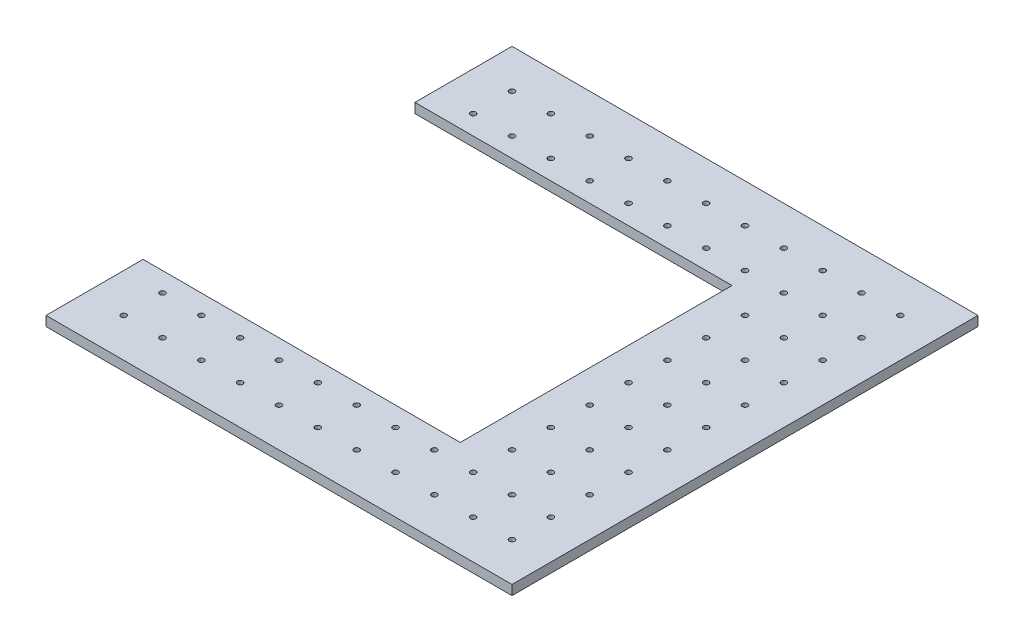
from build123d import *

# Parameters (mm, degrees)
SKETCH1_R           = 1.7907
BOSS_EXTRUDE1_DEPTH = 6.35
SKETCH2_W           = 254
SKETCH2_H           = 177.8
SKETCH2_W_2         = 311.15
SKETCH2_H_2         = 6.35
SKETCH2_W_3         = 6.35
SKETCH2_H_3         = 279.4
SKETCH2_W_4         = 279.4
CUT_EXTRUDE2_DEPTH  = 305.225337561
SKETCH3_W           = 6.35
SKETCH3_H           = 63.5
SKETCH3_H_2         = 25.4
CUT_EXTRUDE3_DEPTH  = 296.250072208


with BuildPart() as part:
    # Sketch1 → Boss-Extrude1 (new body)
    with BuildSketch(Plane(origin=(0, 0, 0), x_dir=(1, 0, 0), z_dir=(0, 1, 0))):
        Polygon((-65.292450766, -101.6), (-39.892450766, -101.6), (-39.892450766, -107.95), (-14.492450766, -107.95), (-14.492450766, -101.6), (10.907549234, -101.6), (10.907549234, -107.95), (36.307549234, -107.95), (36.307549234, -101.6), (61.707549234, -101.6), (61.707549234, -107.95), (87.107549234, -107.95), (87.107549234, -101.6), (112.507549234, -101.6), (112.507549234, -107.95), (137.907549234, -107.95), (137.907549234, -101.6), (163.307549234, -101.6), (163.307549234, -107.95), (188.707549234, -107.95), (188.707549234, -101.6), (220.457549234, -101.6), (220.457549234, -76.2), (214.107549234, -76.2), (214.107549234, -50.8), (220.457549234, -50.8), (220.457549234, -25.4), (214.107549234, -25.4), (214.107549234, 0), (220.457549234, 0), (220.457549234, 25.4), (214.107549234, 25.4), (214.107549234, 50.8), (220.457549234, 50.8), (220.457549234, 76.2), (214.107549234, 76.2), (214.107549234, 101.6), (220.457549234, 101.6), (220.457549234, 127), (214.107549234, 127), (214.107549234, 152.4), (220.457549234, 152.4), (220.457549234, 177.8), (214.107549234, 177.8), (214.107549234, 209.55), (188.707549234, 209.55), (188.707549234, 203.2), (163.307549234, 203.2), (163.307549234, 209.55), (137.907549234, 209.55), (137.907549234, 203.2), (112.507549234, 203.2), (112.507549234, 209.55), (87.107549234, 209.55), (87.107549234, 203.2), (61.707549234, 203.2), (61.707549234, 209.55), (36.307549234, 209.55), (36.307549234, 203.2), (10.907549234, 203.2), (10.907549234, 209.55), (-14.492450766, 209.55), (-14.492450766, 203.2), (-39.892450766, 203.2), (-39.892450766, 209.55), (-65.292450766, 209.55), (-65.292450766, 203.2), (-97.042450766, 203.2), (-97.042450766, 177.8), (-90.692450766, 177.8), (-90.692450766, 152.4), (-97.042450766, 152.4), (-97.042450766, 127), (-90.692450766, 127), (-90.692450766, 101.6), (-97.042450766, 101.6), (-97.042450766, 76.2), (-90.692450766, 76.2), (-90.692450766, 50.8), (-97.042450766, 50.8), (-97.042450766, 25.4), (-90.692450766, 25.4), (-90.692450766, 0), (-97.042450766, 0), (-97.042450766, -25.4), (-90.692450766, -25.4), (-90.692450766, -50.8), (-97.042450766, -50.8), (-97.042450766, -76.2), (-90.692450766, -76.2), (-90.692450766, -107.95), (-65.292450766, -107.95), align=None)
        with Locations((-65.292450766, -76.2)):
            Circle(SKETCH1_R, mode=Mode.SUBTRACT)
        with Locations((-39.892450766, -76.2)):
            Circle(SKETCH1_R, mode=Mode.SUBTRACT)
        with Locations((-14.492450766, -76.2)):
            Circle(SKETCH1_R, mode=Mode.SUBTRACT)
        with Locations((10.907549234, -76.2)):
            Circle(SKETCH1_R, mode=Mode.SUBTRACT)
        with Locations((36.307549234, -76.2)):
            Circle(SKETCH1_R, mode=Mode.SUBTRACT)
        with Locations((61.707549234, -76.2)):
            Circle(SKETCH1_R, mode=Mode.SUBTRACT)
        with Locations((87.107549234, -76.2)):
            Circle(SKETCH1_R, mode=Mode.SUBTRACT)
        with Locations((112.507549234, -76.2)):
            Circle(SKETCH1_R, mode=Mode.SUBTRACT)
        with Locations((137.907549234, -76.2)):
            Circle(SKETCH1_R, mode=Mode.SUBTRACT)
        with Locations((163.307549234, -76.2)):
            Circle(SKETCH1_R, mode=Mode.SUBTRACT)
        with Locations((188.707549234, -76.2)):
            Circle(SKETCH1_R, mode=Mode.SUBTRACT)
        with Locations((-65.292450766, -50.8)):
            Circle(SKETCH1_R, mode=Mode.SUBTRACT)
        with Locations((-65.292450766, -25.4)):
            Circle(SKETCH1_R, mode=Mode.SUBTRACT)
        with Locations((-65.292450766, 0)):
            Circle(SKETCH1_R, mode=Mode.SUBTRACT)
        with Locations((-65.292450766, 25.4)):
            Circle(SKETCH1_R, mode=Mode.SUBTRACT)
        with Locations((-65.292450766, 50.8)):
            Circle(SKETCH1_R, mode=Mode.SUBTRACT)
        with Locations((-65.292450766, 76.2)):
            Circle(SKETCH1_R, mode=Mode.SUBTRACT)
        with Locations((-65.292450766, 101.6)):
            Circle(SKETCH1_R, mode=Mode.SUBTRACT)
        with Locations((-65.292450766, 127)):
            Circle(SKETCH1_R, mode=Mode.SUBTRACT)
        with Locations((-65.292450766, 152.4)):
            Circle(SKETCH1_R, mode=Mode.SUBTRACT)
        with Locations((-65.292450766, 177.8)):
            Circle(SKETCH1_R, mode=Mode.SUBTRACT)
        with Locations((-39.892450766, -50.8)):
            Circle(SKETCH1_R, mode=Mode.SUBTRACT)
        with Locations((-14.492450766, -50.8)):
            Circle(SKETCH1_R, mode=Mode.SUBTRACT)
        with Locations((10.907549234, -50.8)):
            Circle(SKETCH1_R, mode=Mode.SUBTRACT)
        with Locations((36.307549234, -50.8)):
            Circle(SKETCH1_R, mode=Mode.SUBTRACT)
        with Locations((61.707549234, -50.8)):
            Circle(SKETCH1_R, mode=Mode.SUBTRACT)
        with Locations((87.107549234, -50.8)):
            Circle(SKETCH1_R, mode=Mode.SUBTRACT)
        with Locations((112.507549234, -50.8)):
            Circle(SKETCH1_R, mode=Mode.SUBTRACT)
        with Locations((137.907549234, -50.8)):
            Circle(SKETCH1_R, mode=Mode.SUBTRACT)
        with Locations((163.307549234, -50.8)):
            Circle(SKETCH1_R, mode=Mode.SUBTRACT)
        with Locations((188.707549234, -50.8)):
            Circle(SKETCH1_R, mode=Mode.SUBTRACT)
        with Locations((-39.892450766, -25.4)):
            Circle(SKETCH1_R, mode=Mode.SUBTRACT)
        with Locations((-14.492450766, -25.4)):
            Circle(SKETCH1_R, mode=Mode.SUBTRACT)
        with Locations((10.907549234, -25.4)):
            Circle(SKETCH1_R, mode=Mode.SUBTRACT)
        with Locations((36.307549234, -25.4)):
            Circle(SKETCH1_R, mode=Mode.SUBTRACT)
        with Locations((61.707549234, -25.4)):
            Circle(SKETCH1_R, mode=Mode.SUBTRACT)
        with Locations((87.107549234, -25.4)):
            Circle(SKETCH1_R, mode=Mode.SUBTRACT)
        with Locations((112.507549234, -25.4)):
            Circle(SKETCH1_R, mode=Mode.SUBTRACT)
        with Locations((137.907549234, -25.4)):
            Circle(SKETCH1_R, mode=Mode.SUBTRACT)
        with Locations((163.307549234, -25.4)):
            Circle(SKETCH1_R, mode=Mode.SUBTRACT)
        with Locations((188.707549234, -25.4)):
            Circle(SKETCH1_R, mode=Mode.SUBTRACT)
        with Locations((-39.892450766, 0)):
            Circle(SKETCH1_R, mode=Mode.SUBTRACT)
        with Locations((-14.492450766, 0)):
            Circle(SKETCH1_R, mode=Mode.SUBTRACT)
        with Locations((10.907549234, 0)):
            Circle(SKETCH1_R, mode=Mode.SUBTRACT)
        with Locations((36.307549234, 0)):
            Circle(SKETCH1_R, mode=Mode.SUBTRACT)
        with Locations((61.707549234, 0)):
            Circle(SKETCH1_R, mode=Mode.SUBTRACT)
        with Locations((87.107549234, 0)):
            Circle(SKETCH1_R, mode=Mode.SUBTRACT)
        with Locations((112.507549234, 0)):
            Circle(SKETCH1_R, mode=Mode.SUBTRACT)
        with Locations((137.907549234, 0)):
            Circle(SKETCH1_R, mode=Mode.SUBTRACT)
        with Locations((163.307549234, 0)):
            Circle(SKETCH1_R, mode=Mode.SUBTRACT)
        with Locations((188.707549234, 0)):
            Circle(SKETCH1_R, mode=Mode.SUBTRACT)
        with Locations((-39.892450766, 25.4)):
            Circle(SKETCH1_R, mode=Mode.SUBTRACT)
        with Locations((-14.492450766, 25.4)):
            Circle(SKETCH1_R, mode=Mode.SUBTRACT)
        with Locations((10.907549234, 25.4)):
            Circle(SKETCH1_R, mode=Mode.SUBTRACT)
        with Locations((36.307549234, 25.4)):
            Circle(SKETCH1_R, mode=Mode.SUBTRACT)
        with Locations((61.707549234, 25.4)):
            Circle(SKETCH1_R, mode=Mode.SUBTRACT)
        with Locations((87.107549234, 25.4)):
            Circle(SKETCH1_R, mode=Mode.SUBTRACT)
        with Locations((112.507549234, 25.4)):
            Circle(SKETCH1_R, mode=Mode.SUBTRACT)
        with Locations((137.907549234, 25.4)):
            Circle(SKETCH1_R, mode=Mode.SUBTRACT)
        with Locations((163.307549234, 25.4)):
            Circle(SKETCH1_R, mode=Mode.SUBTRACT)
        with Locations((188.707549234, 25.4)):
            Circle(SKETCH1_R, mode=Mode.SUBTRACT)
        with Locations((-39.892450766, 50.8)):
            Circle(SKETCH1_R, mode=Mode.SUBTRACT)
        with Locations((-14.492450766, 50.8)):
            Circle(SKETCH1_R, mode=Mode.SUBTRACT)
        with Locations((10.907549234, 50.8)):
            Circle(SKETCH1_R, mode=Mode.SUBTRACT)
        with Locations((36.307549234, 50.8)):
            Circle(SKETCH1_R, mode=Mode.SUBTRACT)
        with Locations((61.707549234, 50.8)):
            Circle(SKETCH1_R, mode=Mode.SUBTRACT)
        with Locations((87.107549234, 50.8)):
            Circle(SKETCH1_R, mode=Mode.SUBTRACT)
        with Locations((112.507549234, 50.8)):
            Circle(SKETCH1_R, mode=Mode.SUBTRACT)
        with Locations((137.907549234, 50.8)):
            Circle(SKETCH1_R, mode=Mode.SUBTRACT)
        with Locations((163.307549234, 50.8)):
            Circle(SKETCH1_R, mode=Mode.SUBTRACT)
        with Locations((188.707549234, 50.8)):
            Circle(SKETCH1_R, mode=Mode.SUBTRACT)
        with Locations((-39.892450766, 76.2)):
            Circle(SKETCH1_R, mode=Mode.SUBTRACT)
        with Locations((-14.492450766, 76.2)):
            Circle(SKETCH1_R, mode=Mode.SUBTRACT)
        with Locations((10.907549234, 76.2)):
            Circle(SKETCH1_R, mode=Mode.SUBTRACT)
        with Locations((36.307549234, 76.2)):
            Circle(SKETCH1_R, mode=Mode.SUBTRACT)
        with Locations((61.707549234, 76.2)):
            Circle(SKETCH1_R, mode=Mode.SUBTRACT)
        with Locations((87.107549234, 76.2)):
            Circle(SKETCH1_R, mode=Mode.SUBTRACT)
        with Locations((112.507549234, 76.2)):
            Circle(SKETCH1_R, mode=Mode.SUBTRACT)
        with Locations((137.907549234, 76.2)):
            Circle(SKETCH1_R, mode=Mode.SUBTRACT)
        with Locations((163.307549234, 76.2)):
            Circle(SKETCH1_R, mode=Mode.SUBTRACT)
        with Locations((188.707549234, 76.2)):
            Circle(SKETCH1_R, mode=Mode.SUBTRACT)
        with Locations((-39.892450766, 101.6)):
            Circle(SKETCH1_R, mode=Mode.SUBTRACT)
        with Locations((-14.492450766, 101.6)):
            Circle(SKETCH1_R, mode=Mode.SUBTRACT)
        with Locations((10.907549234, 101.6)):
            Circle(SKETCH1_R, mode=Mode.SUBTRACT)
        with Locations((36.307549234, 101.6)):
            Circle(SKETCH1_R, mode=Mode.SUBTRACT)
        with Locations((61.707549234, 101.6)):
            Circle(SKETCH1_R, mode=Mode.SUBTRACT)
        with Locations((87.107549234, 101.6)):
            Circle(SKETCH1_R, mode=Mode.SUBTRACT)
        with Locations((112.507549234, 101.6)):
            Circle(SKETCH1_R, mode=Mode.SUBTRACT)
        with Locations((137.907549234, 101.6)):
            Circle(SKETCH1_R, mode=Mode.SUBTRACT)
        with Locations((163.307549234, 101.6)):
            Circle(SKETCH1_R, mode=Mode.SUBTRACT)
        with Locations((188.707549234, 101.6)):
            Circle(SKETCH1_R, mode=Mode.SUBTRACT)
        with Locations((-39.892450766, 127)):
            Circle(SKETCH1_R, mode=Mode.SUBTRACT)
        with Locations((-14.492450766, 127)):
            Circle(SKETCH1_R, mode=Mode.SUBTRACT)
        with Locations((10.907549234, 127)):
            Circle(SKETCH1_R, mode=Mode.SUBTRACT)
        with Locations((36.307549234, 127)):
            Circle(SKETCH1_R, mode=Mode.SUBTRACT)
        with Locations((61.707549234, 127)):
            Circle(SKETCH1_R, mode=Mode.SUBTRACT)
        with Locations((87.107549234, 127)):
            Circle(SKETCH1_R, mode=Mode.SUBTRACT)
        with Locations((112.507549234, 127)):
            Circle(SKETCH1_R, mode=Mode.SUBTRACT)
        with Locations((137.907549234, 127)):
            Circle(SKETCH1_R, mode=Mode.SUBTRACT)
        with Locations((163.307549234, 127)):
            Circle(SKETCH1_R, mode=Mode.SUBTRACT)
        with Locations((188.707549234, 127)):
            Circle(SKETCH1_R, mode=Mode.SUBTRACT)
        with Locations((-39.892450766, 152.4)):
            Circle(SKETCH1_R, mode=Mode.SUBTRACT)
        with Locations((-14.492450766, 152.4)):
            Circle(SKETCH1_R, mode=Mode.SUBTRACT)
        with Locations((10.907549234, 152.4)):
            Circle(SKETCH1_R, mode=Mode.SUBTRACT)
        with Locations((36.307549234, 152.4)):
            Circle(SKETCH1_R, mode=Mode.SUBTRACT)
        with Locations((61.707549234, 152.4)):
            Circle(SKETCH1_R, mode=Mode.SUBTRACT)
        with Locations((87.107549234, 152.4)):
            Circle(SKETCH1_R, mode=Mode.SUBTRACT)
        with Locations((112.507549234, 152.4)):
            Circle(SKETCH1_R, mode=Mode.SUBTRACT)
        with Locations((137.907549234, 152.4)):
            Circle(SKETCH1_R, mode=Mode.SUBTRACT)
        with Locations((163.307549234, 152.4)):
            Circle(SKETCH1_R, mode=Mode.SUBTRACT)
        with Locations((188.707549234, 152.4)):
            Circle(SKETCH1_R, mode=Mode.SUBTRACT)
        with Locations((-39.892450766, 177.8)):
            Circle(SKETCH1_R, mode=Mode.SUBTRACT)
        with Locations((-14.492450766, 177.8)):
            Circle(SKETCH1_R, mode=Mode.SUBTRACT)
        with Locations((10.907549234, 177.8)):
            Circle(SKETCH1_R, mode=Mode.SUBTRACT)
        with Locations((36.307549234, 177.8)):
            Circle(SKETCH1_R, mode=Mode.SUBTRACT)
        with Locations((61.707549234, 177.8)):
            Circle(SKETCH1_R, mode=Mode.SUBTRACT)
        with Locations((87.107549234, 177.8)):
            Circle(SKETCH1_R, mode=Mode.SUBTRACT)
        with Locations((112.507549234, 177.8)):
            Circle(SKETCH1_R, mode=Mode.SUBTRACT)
        with Locations((137.907549234, 177.8)):
            Circle(SKETCH1_R, mode=Mode.SUBTRACT)
        with Locations((163.307549234, 177.8)):
            Circle(SKETCH1_R, mode=Mode.SUBTRACT)
        with Locations((188.707549234, 177.8)):
            Circle(SKETCH1_R, mode=Mode.SUBTRACT)
    extrude(amount=BOSS_EXTRUDE1_DEPTH)

    # Sketch2 → Cut-Extrude2 (cut, through all)
    with BuildSketch(Plane(origin=(0, 6.35, 0), x_dir=(1, 0, 0), z_dir=(0, 1, 0))):
        with Locations((-10.249101816, 50.8)):
            Rectangle(SKETCH2_W, SKETCH2_H)
        with Locations((58.532549234, 206.375)):
            Rectangle(SKETCH2_W_2, SKETCH2_H_2)
        with Locations((217.282549234, 38.1)):
            Rectangle(SKETCH2_W_3, SKETCH2_H_3)
        with Locations((49.007549234, -104.775)):
            Rectangle(SKETCH2_W_4, SKETCH2_H_2)
    extrude(amount=-CUT_EXTRUDE2_DEPTH, mode=Mode.SUBTRACT)

    # Sketch3 → Cut-Extrude3 (cut, through all)
    with BuildSketch(Plane(origin=(0, 6.35, 0), x_dir=(1, 0, 0), z_dir=(0, 1, 0))):
        with Locations((-93.867450766, 171.45)):
            Rectangle(SKETCH3_W, SKETCH3_H)
        with Locations((-93.867450766, -63.5)):
            Rectangle(SKETCH3_W, SKETCH3_H_2)
    extrude(amount=-CUT_EXTRUDE3_DEPTH, mode=Mode.SUBTRACT)


solid = part.part
